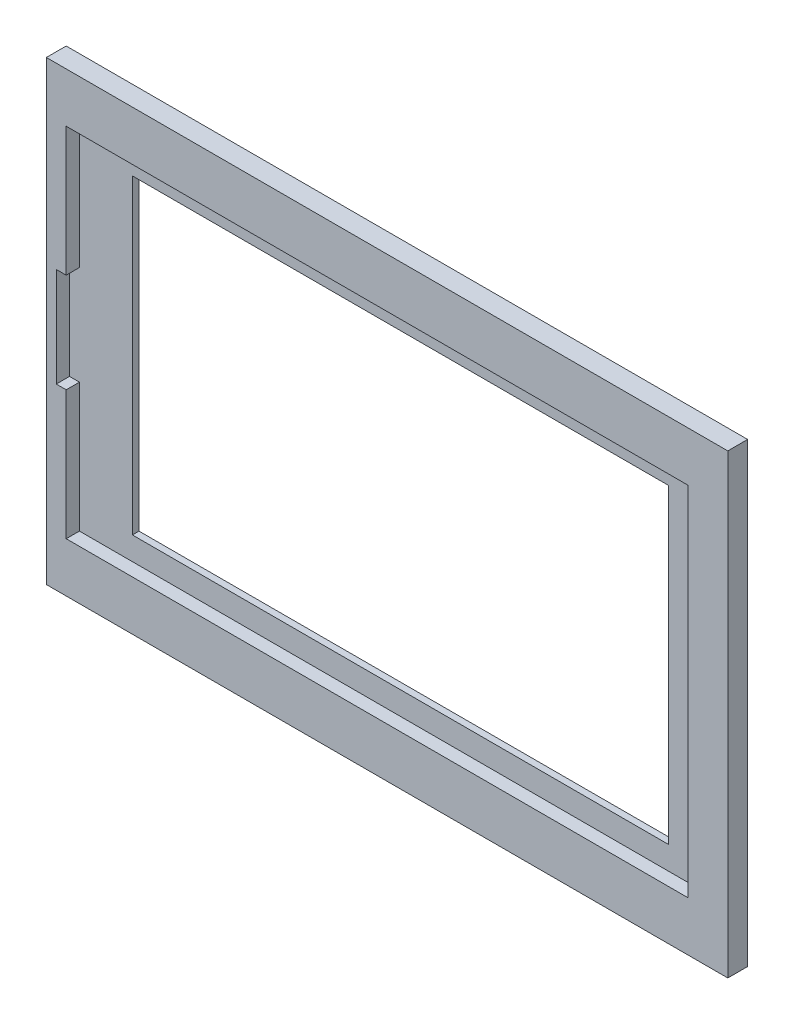
from build123d import *

# Parameters (mm, degrees)
SKETCH1_W           = 103
SKETCH1_H           = 69
BOSS_EXTRUDE1_DEPTH = 3
SKETCH2_W           = 81
SKETCH2_H           = 47
CUT_EXTRUDE1_DEPTH  = 3
CUT_EXTRUDE2_DEPTH  = 2


with BuildPart() as part:
    # Sketch1 → Boss-Extrude1 (new body)
    with BuildSketch(Plane.XY):
        with Locations((62.328366078, 28.443882797)):
            Rectangle(SKETCH1_W, SKETCH1_H)
    extrude(amount=BOSS_EXTRUDE1_DEPTH)

    # Sketch2 → Cut-Extrude1 (cut)
    with BuildSketch(Plane.XY.offset(3)):
        with Locations((62.328366078, 28.443882797)):
            Rectangle(SKETCH2_W, SKETCH2_H)
    extrude(amount=-CUT_EXTRUDE1_DEPTH, mode=Mode.SUBTRACT)

    # Sketch3 → Cut-Extrude2 (cut)
    with BuildSketch(Plane.XY.offset(3)):
        Polygon((13.828366078, 55.443882797), (107.828366078, 55.443882797), (107.828366078, 1.443882797), (13.828366078, 1.443882797), (13.828366078, 20.943882797), (12.328366078, 20.943882797), (12.328366078, 35.943882797), (13.828366078, 35.943882797), align=None)
    extrude(amount=-CUT_EXTRUDE2_DEPTH, mode=Mode.SUBTRACT)


solid = part.part
